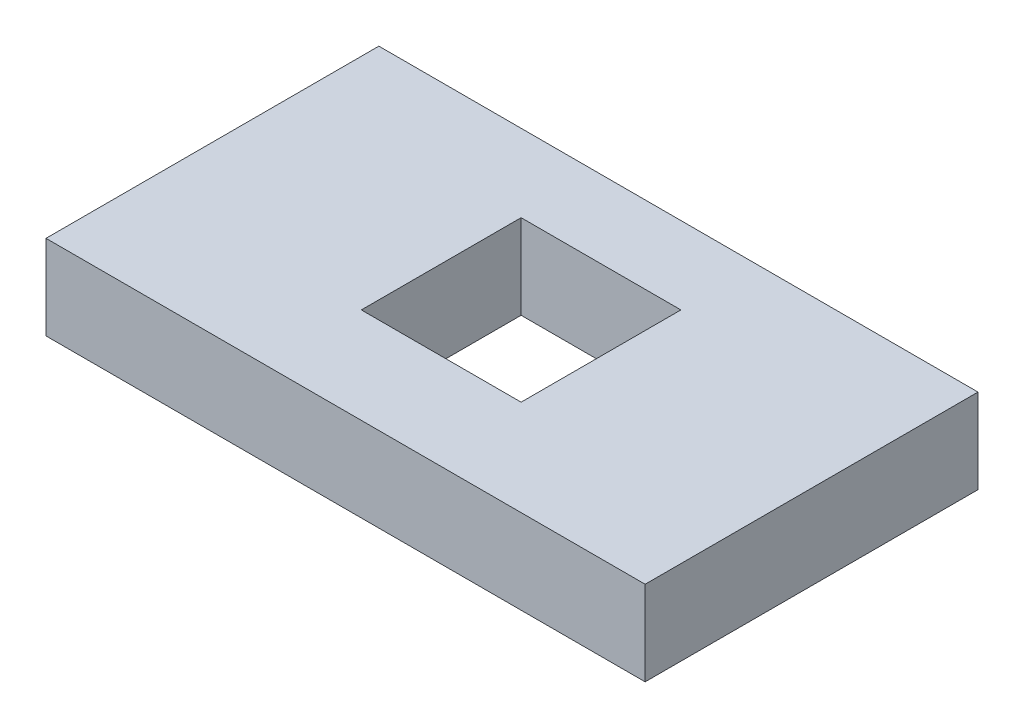
from build123d import *

# Parameters (mm, degrees)
SKETCH1_W           = 45
SKETCH1_H           = 25
BOSS_EXTRUDE1_DEPTH = 6.35
SKETCH2_W           = 12
SKETCH2_H           = 12
CUT_EXTRUDE1_DEPTH  = 52.868318847


with BuildPart() as part:
    # Sketch1 → Boss-Extrude1 (new body)
    with BuildSketch(Plane(origin=(0, 0, 0), x_dir=(1, 0, 0), z_dir=(0, 1, 0))):
        with Locations((22.5, 12.5)):
            Rectangle(SKETCH1_W, SKETCH1_H)
    extrude(amount=BOSS_EXTRUDE1_DEPTH)

    # Sketch2 → Cut-Extrude1 (cut, through all)
    with BuildSketch(Plane.XZ):
        with Locations((22.5, -13.184819353)):
            Rectangle(SKETCH2_W, SKETCH2_H)
    extrude(amount=-CUT_EXTRUDE1_DEPTH, mode=Mode.SUBTRACT)


solid = part.part
